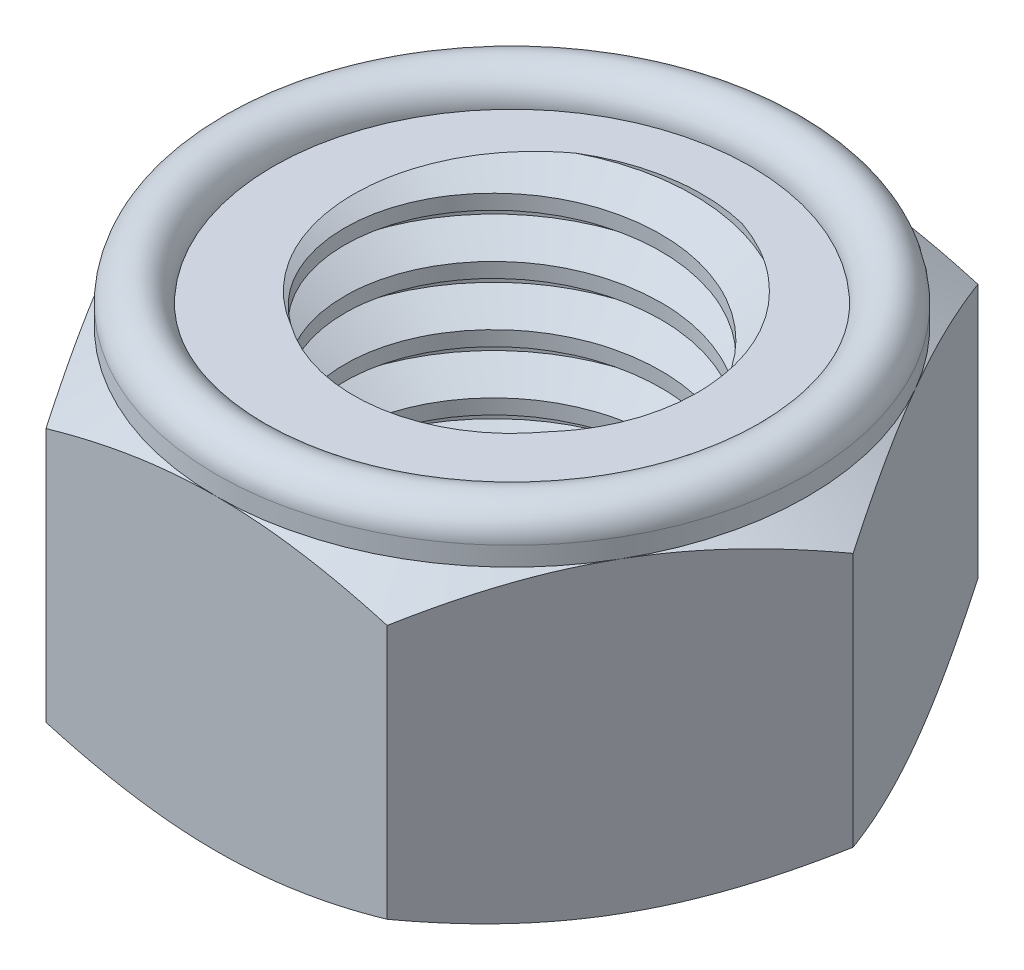
from build123d import *

# Parameters (mm, degrees)
BOSS_EXTRUDE1_DEPTH = 9.525
THREAD1_PITCH       = 1.5875


with BuildPart() as part:
    # Sketch1 → Boss-Extrude1 (new body)
    with BuildSketch(Plane(origin=(0, 0, 0), x_dir=(1, 0, 0), z_dir=(0, 1, 0))):
        Polygon((-9.165435523, 0), (-4.582717762, -7.9375), (4.582717762, -7.9375), (9.165435523, 0), (4.582717762, 7.9375), (-4.582717762, 7.9375), align=None)
    extrude(amount=BOSS_EXTRUDE1_DEPTH)

    # Sketch2 → Cut-Revolve1 (revolve, cut)
    with BuildSketch(Plane.XY, mode=Mode.PRIVATE) as cut_revolve1_sk:
        with BuildLine():
            Line((0, 9.525), (-7.1755, 9.525))
            ThreePointArc((-7.1755, 9.525), (-6.636684633, 9.301815367), (-6.4135, 8.763))
            Line((-6.4135, 8.763), (-4.2545, 8.763))
            Line((-4.2545, 8.763), (-4.2545, 0))
            Line((-4.2545, 0), (0, 0))
            Line((0, 0), (0, 9.525))
        make_face()
        with BuildLine():
            Line((-9.165435523, 9.525), (-9.165435523, 7.546051095))
            Line((-9.165435523, 7.546051095), (-7.9375, 8.255))
            Line((-7.9375, 8.255), (-7.9375, 8.763))
            ThreePointArc((-7.9375, 8.763), (-7.714315367, 9.301815367), (-7.1755, 9.525))
            Line((-7.1755, 9.525), (-9.165435523, 9.525))
        make_face()
        Polygon((-9.165435523, 0), (-9.165435523, 0.708948905), (-7.9375, 0), align=None)
    revolve(cut_revolve1_sk.sketch.rotate(Axis((0, 0, 0), (0, 1, 0)), 270), axis=Axis((0, 0, 0), (0, 1, 0)), mode=Mode.SUBTRACT)

    # Thread1: the profile of Thread Profile1 profile screwed along a right-hand helix of 9.6 turns, 8 arcs to a turn; built about Z, then put on its axis
    thread1_z = Axis((0, 0, 0), (0, 0, 1))
    thread1_corners = [(4.2542, 0, -0.000173205), (5.113759577, 0, 0.496093748), (5.113759577, 0, 0.694531248), (4.2542, 0, 1.190798201)]
    with BuildLine(mode=Mode.PRIVATE) as thread1_profile:
        Line(thread1_corners[0], thread1_corners[1])
        Line(thread1_corners[1], thread1_corners[2])
        Line(thread1_corners[2], thread1_corners[3])
        Line(thread1_corners[3], thread1_corners[0])
    thread1_cap = Face(thread1_profile.wire())
    thread1_turn_angles = [0, 22.5, 45, 67.5, 90, 112.5, 135, 157.5, 180, 202.5, 225, 247.5, 270, 292.5, 315, 337.5, 360]
    thread1_turn_weights = [1, 0.9238795325112867, 1, 0.9238795325112867, 1, 0.9238795325112867, 1, 0.9238795325112867, 1, 0.9238795325112867, 1, 0.9238795325112867, 1, 0.9238795325112867, 1, 0.9238795325112867, 1]
    thread1_turn_rails = [Edge.make_bspline([Vector(p[0], p[1], 0).rotate(thread1_z, thread1_turn_angles[k]) / thread1_turn_weights[k] + Vector(0, 0, p[2] + THREAD1_PITCH * thread1_turn_angles[k] / 360) for k in range(17)], [0, 0, 0, 1, 1, 2, 2, 3, 3, 4, 4, 5, 5, 6, 6, 7, 7, 8, 8, 8], 2, thread1_turn_weights) for p in thread1_corners]
    thread1_turn_sides = [Face.make_surface_from_curves(thread1_turn_rails[p[0]], thread1_turn_rails[p[1]]) for p in [(0, 1), (1, 2), (2, 3), (3, 0)]]
    thread1_last_angles = [3240, 3262.5, 3285, 3307.5, 3330, 3352.5, 3375, 3397.5, 3420, 3438, 3456]
    thread1_last_weights = [1, 0.9238795325112867, 1, 0.9238795325112867, 1, 0.9238795325112867, 1, 0.9238795325112867, 1, 0.9510565162951535, 1]
    thread1_last_rails = [Edge.make_bspline([Vector(p[0], p[1], 0).rotate(thread1_z, thread1_last_angles[k]) / thread1_last_weights[k] + Vector(0, 0, p[2] + THREAD1_PITCH * thread1_last_angles[k] / 360) for k in range(11)], [0, 0, 0, 1, 1, 2, 2, 3, 3, 4, 4, 5, 5, 5], 2, thread1_last_weights) for p in thread1_corners]
    thread1_last_sides = [Face.make_surface_from_curves(thread1_last_rails[p[0]], thread1_last_rails[p[1]]) for p in [(0, 1), (1, 2), (2, 3), (3, 0)]]
    thread1 = Plane(origin=(0, 11.303, 0), x_dir=(-1, 0, 0), z_dir=(0, -1, 0)) * Solid(Shell([*[p.moved(Location((0, 0, THREAD1_PITCH * i))) for i in range(9) for p in thread1_turn_sides], *thread1_last_sides, thread1_cap, thread1_cap.rotate(thread1_z, 3456).moved(Location((0, 0, THREAD1_PITCH * 3456 / 360)))]))
    add(thread1, mode=Mode.SUBTRACT)


solid = part.part
